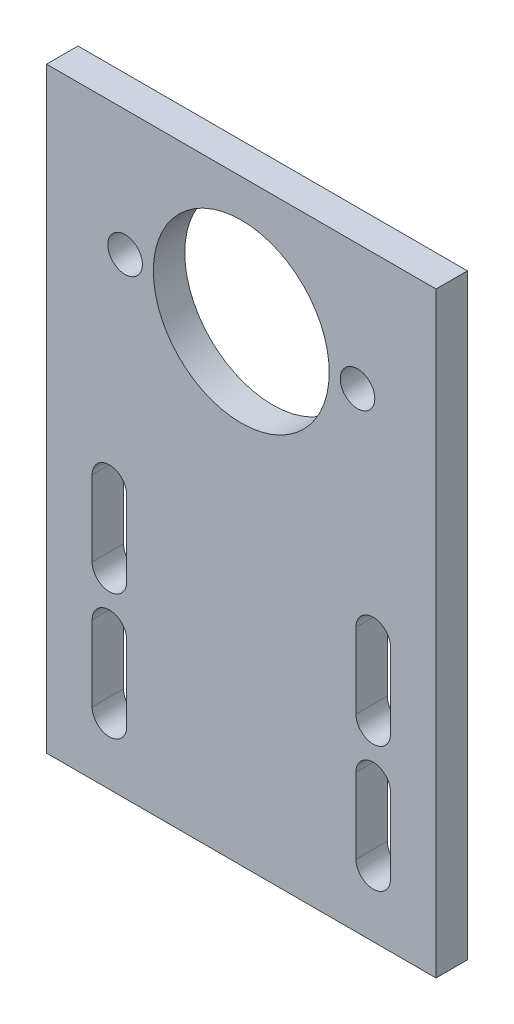
from build123d import *

# Parameters (mm, degrees)
SKETCH1_R           = 2.75
SKETCH1_R_2         = 14
BOSS_EXTRUDE1_DEPTH = 5


with BuildPart() as part:
    # Sketch1 → Boss-Extrude1 (new body)
    with BuildSketch(Plane.XY):
        Polygon((-35, 60), (-35, -15), (-35, -35), (27, -35), (27, -15), (27, 60), align=None)
        with BuildLine():
            ThreePointArc((-22.25, -25), (-25, -27.75), (-27.75, -25))
            Line((-27.75, -25), (-27.75, -13))
            ThreePointArc((-27.75, -13), (-25, -10.25), (-22.25, -13))
            Line((-22.25, -13), (-22.25, -25))
        make_face(mode=Mode.SUBTRACT)
        with BuildLine():
            ThreePointArc((-22.25, -5), (-25, -7.75), (-27.75, -5))
            Line((-27.75, -5), (-27.75, 7))
            ThreePointArc((-27.75, 7), (-25, 9.75), (-22.25, 7))
            Line((-22.25, 7), (-22.25, -5))
        make_face(mode=Mode.SUBTRACT)
        with BuildLine():
            Line((19.75, -13), (19.75, -25))
            ThreePointArc((19.75, -25), (17, -27.75), (14.25, -25))
            Line((14.25, -25), (14.25, -13))
            ThreePointArc((14.25, -13), (17, -10.25), (19.75, -13))
        make_face(mode=Mode.SUBTRACT)
        with BuildLine():
            Line((19.75, 7), (19.75, -5))
            ThreePointArc((19.75, -5), (17, -7.75), (14.25, -5))
            Line((14.25, -5), (14.25, 7))
            ThreePointArc((14.25, 7), (17, 9.75), (19.75, 7))
        make_face(mode=Mode.SUBTRACT)
        with Locations((-22.5, 40)):
            Circle(SKETCH1_R, mode=Mode.SUBTRACT)
        with Locations((-4, 40)):
            Circle(SKETCH1_R_2, mode=Mode.SUBTRACT)
        with Locations((14.5, 40)):
            Circle(SKETCH1_R, mode=Mode.SUBTRACT)
    extrude(amount=BOSS_EXTRUDE1_DEPTH)


solid = part.part
